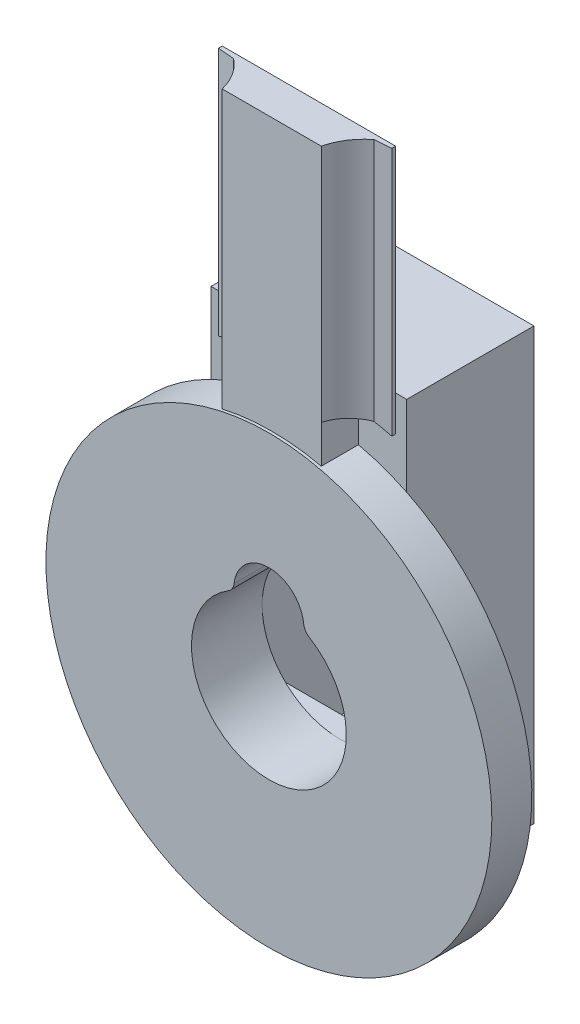
from build123d import *
from build123d.topology import SkipClean

# Parameters (mm, degrees)
CROQUIS1_R                 = 18
SALIENTE_EXTRUIR1_DEPTH    = 3.5
SALIENTE_EXTRUIR5_DEPTH    = 3.27
CORTAR_EXTRUIR4_REACH      = 62.83
CORTAR_EXTRUIR4_END_RADIUS = 18
CROQUIS5_W                 = 14
CROQUIS5_H                 = 0.27
CORTAR_EXTRUIR2_DEPTH      = 21
CORTAR_EXTRUIR5_DEPTH      = 10
SALIENTE_EXTRUIR6_START    = -2.2
SALIENTE_EXTRUIR6_DEPTH    = 2.2
CORTAR_EXTRUIR8_START      = 0.27
CROQUIS8_R                 = 18
CORTAR_EXTRUIR8_DEPTH      = 0.27
SALIENTE_EXTRUIR7_START    = 2.47
SALIENTE_EXTRUIR7_DEPTH    = 2.47
SALIENTE_EXTRUIR9_DEPTH    = 10
CORTAR_EXTRUIR9_START      = 10
CORTAR_EXTRUIR9_DEPTH      = 10
CROQUIS13_W                = 12.6
CROQUIS13_H                = 4.84
CROQUIS13_H_2              = 4.65
SALIENTE_EXTRUIR10_DEPTH   = 4
CROQUIS12_R                = 1
CORTAR_EXTRUIR10_DEPTH     = 18.85


with BuildPart() as part:
    # Croquis1 → Saliente-Extruir1 (new body)
    with BuildSketch(Plane.XY):
        Circle(CROQUIS1_R)
    extrude(amount=SALIENTE_EXTRUIR1_DEPTH)

    # Croquis2 → Saliente-Extruir5 (add)
    with BuildSketch(Plane.XY):
        with BuildLine():
            Line((4, 39.111635425), (4, 20.615528128))
            ThreePointArc((4, 20.615528128), (5.515132245, 20.262855582), (7, 19.798989873))
            Line((7, 19.798989873), (7, 39.928035252))
            Line((7, 39.928035252), (4, 39.928035252))
            Line((4, 39.928035252), (4, 39.111635425))
        make_face()
        with BuildLine():
            Line((-4, 20.615528128), (-4, 17.549928775))
            ThreePointArc((-4, 17.549928775), (0, 18), (4, 17.549928775))
            Line((4, 17.549928775), (4, 20.615528128))
            ThreePointArc((4, 20.615528128), (0, 21), (-4, 20.615528128))
        make_face()
        with BuildLine():
            Line((-4, 39.111635425), (-4, 20.615528128))
            ThreePointArc((-4, 20.615528128), (0, 21), (4, 20.615528128))
            Line((4, 20.615528128), (4, 39.111635425))
            Line((4, 39.111635425), (4, 39.928035252))
            Line((4, 39.928035252), (-4, 39.928035252))
            Line((-4, 39.928035252), (-4, 39.111635425))
        make_face()
        with BuildLine():
            ThreePointArc((-7, 19.798989873), (-5.515132245, 20.262855582), (-4, 20.615528128))
            Line((-4, 20.615528128), (-4, 39.111635425))
            Line((-4, 39.111635425), (-4, 39.928035252))
            Line((-4, 39.928035252), (-7, 39.928035252))
            Line((-7, 39.928035252), (-7, 19.798989873))
        make_face()
    extrude(amount=SALIENTE_EXTRUIR5_DEPTH)

    # Cortar-Extruir4: up to this cylinder (the profile starts outside it)
    with SkipClean():  # the faces are left unmerged after this step: merging them gives an invalid solid
        cortar_extruir4_end = Plane(origin=(0, 0, 0.135), z_dir=(0, 0, -1)) * Cylinder(CORTAR_EXTRUIR4_END_RADIUS, 162.66, mode=Mode.PRIVATE)
        # Croquis5 → Cortar-Extruir4 (cut, up to the surface)
        with BuildSketch(Plane(origin=(0, 40, 0), x_dir=(1, 0, 0), z_dir=(0, 1, 0)), mode=Mode.PRIVATE) as cortar_extruir4_sk1:
            with Locations((0, -0.135)):
                Rectangle(CROQUIS5_W, CROQUIS5_H)
        cortar_extruir4_tool1 = extrude(cortar_extruir4_sk1.sketch, amount=-CORTAR_EXTRUIR4_REACH, mode=Mode.PRIVATE) - cortar_extruir4_end
        add(cortar_extruir4_tool1.solids().sort_by_distance((0, 40, 0.135))[0], mode=Mode.SUBTRACT)
    add(part.part.scale(1), mode=Mode.REPLACE)  # the faces are merged on a copy

    # Croquis4 → Cortar-Extruir2 (cut)
    with BuildSketch(Plane(origin=(0, 40, 0), x_dir=(1, 0, 0), z_dir=(0, 1, 0))):
        with BuildLine():
            Line((-5.666001987, -0.685021683), (-7, -0.573296162))
            Line((-7, -0.573296162), (-7, -3.27))
            Line((-7, -3.27), (-4, -3.27))
            ThreePointArc((-4, -3.27), (-4.613533351, -1.83606535), (-5.666001987, -0.685021683))
        make_face()
        with BuildLine():
            ThreePointArc((5.666001987, -0.685021683), (4.613533351, -1.83606535), (4, -3.27))
            Line((4, -3.27), (7, -3.27))
            Line((7, -3.27), (7, -0.573296162))
            Line((7, -0.573296162), (5.666001987, -0.685021683))
        make_face()
    extrude(amount=-CORTAR_EXTRUIR2_DEPTH, mode=Mode.SUBTRACT)

    # Croquis6 → Cortar-Extruir5 (cut)
    with BuildSketch(Plane.XY):
        with BuildLine():
            ThreePointArc((-3.277147796, 5.321917166), (0, -6.25), (3.277147796, 5.321917166))
            ThreePointArc((3.277147796, 5.321917166), (2.956843582, 5.638101589), (2.807637471, 6.062724851))
            ThreePointArc((2.807637471, 6.062724851), (0, 8.575), (-2.807637471, 6.062724851))
            ThreePointArc((-2.807637471, 6.062724851), (-2.956843582, 5.638101589), (-3.277147796, 5.321917166))
        make_face()
    extrude(amount=CORTAR_EXTRUIR5_DEPTH, mode=Mode.SUBTRACT)

    # Croquis7 → Saliente-Extruir6 (add)
    with SkipClean():  # the faces are left unmerged after this step: merging them gives an invalid solid
        with BuildSketch(Plane.XY.offset(SALIENTE_EXTRUIR6_START)):
            with BuildLine():
                ThreePointArc((-5.596720258, 7.364728261), (0, -9.25), (5.596720258, 7.364728261))
                ThreePointArc((5.596720258, 7.364728261), (0, 11.575), (-5.596720258, 7.364728261))
            make_face()
            with BuildLine():
                ThreePointArc((-3.277147796, 5.321917166), (0, -6.25), (3.277147796, 5.321917166))
                ThreePointArc((3.277147796, 5.321917166), (2.956843582, 5.638101589), (2.807637471, 6.062724851))
                ThreePointArc((2.807637471, 6.062724851), (0, 8.575), (-2.807637471, 6.062724851))
                ThreePointArc((-2.807637471, 6.062724851), (-2.956843582, 5.638101589), (-3.277147796, 5.321917166))
            make_face(mode=Mode.SUBTRACT)
        extrude(amount=SALIENTE_EXTRUIR6_DEPTH)

    # Croquis8 → Cortar-Extruir8 (cut)
    with BuildSketch(Plane(origin=(0, 0, 0.27), x_dir=(-1, 0, 0), z_dir=(0, 0, -1)).offset(CORTAR_EXTRUIR8_START)):
        with Locations(Location((0, 0, 0), (0, 0, 77.160411593))):
            Circle(CROQUIS8_R)
        with BuildLine():
            ThreePointArc((-5.596720258, 7.364728261), (0, -9.25), (5.596720258, 7.364728261))
            ThreePointArc((5.596720258, 7.364728261), (0, 11.575), (-5.596720258, 7.364728261))
        make_face(mode=Mode.SUBTRACT)
    extrude(amount=-CORTAR_EXTRUIR8_DEPTH, mode=Mode.SUBTRACT)

    # Croquis9 → Saliente-Extruir7 (add)
    with BuildSketch(Plane(origin=(0, 0, 0.27), x_dir=(-1, 0, 0), z_dir=(0, 0, -1)).offset(SALIENTE_EXTRUIR7_START)):
        with BuildLine():
            Line((-7.9, -4.81170448), (-7.9, -12.127391994))
            Line((-7.9, -12.127391994), (7.9, -12.127391994))
            Line((7.9, -12.127391994), (7.9, -4.81170448))
            ThreePointArc((7.9, -4.81170448), (0, -9.25), (-7.9, -4.81170448))
        make_face()
        with BuildLine():
            Line((-7.9, 22.672608006), (-7.9, 4.81170448))
            ThreePointArc((-7.9, 4.81170448), (-6.868030798, 6.196180514), (-5.596720258, 7.364728261))
            ThreePointArc((-5.596720258, 7.364728261), (0, 11.575), (5.596720258, 7.364728261))
            ThreePointArc((5.596720258, 7.364728261), (6.868030798, 6.196180514), (7.9, 4.81170448))
            Line((7.9, 4.81170448), (7.9, 22.672608006))
            Line((7.9, 22.672608006), (-7.9, 22.672608006))
        make_face()
    extrude(amount=-SALIENTE_EXTRUIR7_DEPTH)

    # Croquis10 → Saliente-Extruir9 (add)
    with BuildSketch(Plane.XY):
        Polygon((-7.9, -12.127391994), (0, -12.127391994), (7.9, -12.127391994), (7.9, -10.927391994), (7.9, 21.472608006), (7.9, 22.672608006), (-7.9, 22.672608006), (-7.9, 21.472608006), (-7.9, 5.272608006), (-7.9, -10.927391994), align=None)
        Polygon((-6.3, -6.277391994), (-6.3, 0), (-6.3, 5.272608006), (-6.3, 16.532608006), (-6.3, 19.872608006), (-6.3, 21.472608006), (6.3, 21.472608006), (6.3, 19.872608006), (6.3, 16.532608006), (6.3, -6.277391994), (6.3, -9.327391994), (6.3, -10.927391994), (0, -10.927391994), (-6.3, -10.927391994), (-6.3, -9.327391994), align=None, mode=Mode.SUBTRACT)
    extrude(amount=-SALIENTE_EXTRUIR9_DEPTH)

    # Croquis11 → Cortar-Extruir9 (cut)
    with BuildSketch(Plane(origin=(0, 0, 0.27), x_dir=(-1, 0, 0), z_dir=(0, 0, -1)).offset(CORTAR_EXTRUIR9_START)):
        with BuildLine():
            Line((7.9, 4.81170448), (7.9, -4.81170448))
            ThreePointArc((7.9, -4.81170448), (9.25, 0), (7.9, 4.81170448))
        make_face()
        with BuildLine():
            Line((-7.9, -4.81170448), (-7.9, 4.81170448))
            ThreePointArc((-7.9, 4.81170448), (-9.25, 0), (-7.9, -4.81170448))
        make_face()
    extrude(amount=-CORTAR_EXTRUIR9_DEPTH, mode=Mode.SUBTRACT)

    # Croquis13 → Saliente-Extruir10 (add)
    with BuildSketch(Plane.XY):
        with Locations((0, 19.052608006)):
            Rectangle(CROQUIS13_W, CROQUIS13_H)
        with Locations((0, -8.602391994)):
            Rectangle(CROQUIS13_W, CROQUIS13_H_2)
    extrude(amount=-SALIENTE_EXTRUIR10_DEPTH)

    # Croquis12 → Cortar-Extruir10 (cut)
    with BuildSketch(Plane(origin=(0, 0, 0.27), x_dir=(-1, 0, 0), z_dir=(0, 0, -1))):
        with Locations(Location((0, 18.832608006, 0), (0, 0, 180))):
            Circle(CROQUIS12_R)
        with Locations(Location((0, -8.287391994, 0), (0, 0, 180))):
            Circle(CROQUIS12_R)
    extrude(amount=CORTAR_EXTRUIR10_DEPTH, mode=Mode.SUBTRACT)


solid = part.part
